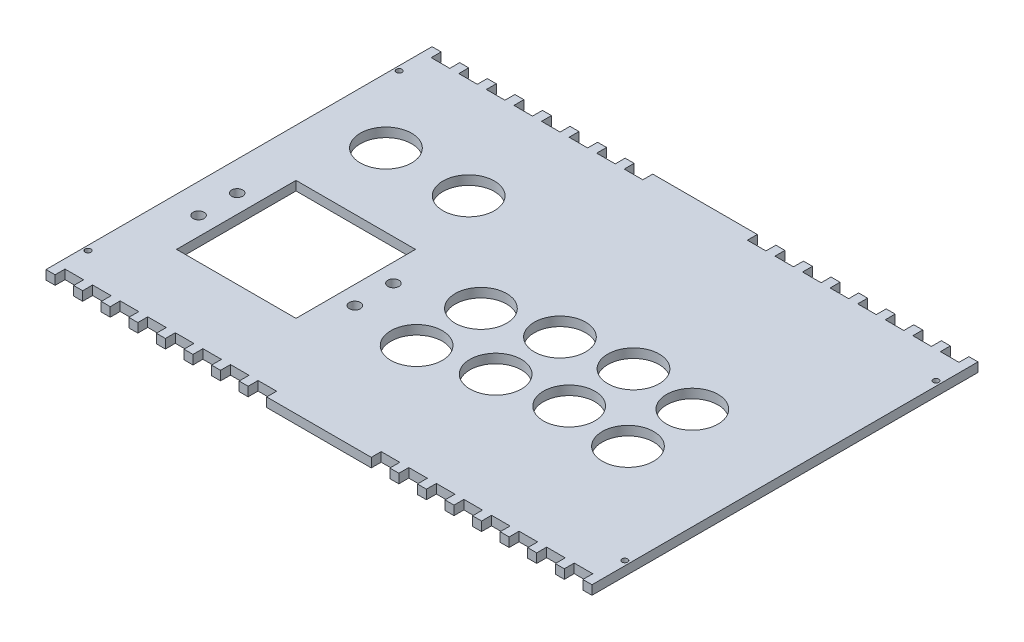
from build123d import *

# Parameters (mm, degrees)
ESQUISSE1_W                 = 297
ESQUISSE1_H                 = 210
BOSS_EXTRU_1_DEPTH          = 5
ENL_V_MAT_EXTRU_1_REACH     = 183.94
ESQUISSE2_W                 = 65
ESQUISSE2_H                 = 65
ESQUISSE2_R                 = 3
SYM_TRIE8_OUTLINE_R         = 3
SYM_TRIE8_DEPTH             = 5
ENL_V_MAT_EXTRU_2_REACH     = 183.94
ESQUISSE3_R                 = 14
ENL_V_MAT_EXTRU_3_REACH     = 183.94
ESQUISSE4_R                 = 14
R_P_TITION_LIN_AIRE1_COUNT  = 2
R_P_TITION_LIN_AIRE1_PITCH  = 35
ESQUISSE5_W                 = 10.1
ESQUISSE5_H                 = 5.4
ENL_V_MAT_EXTRU_4_DEPTH     = 5
R_P_TITION_LIN_AIRE2_COUNT  = 8
R_P_TITION_LIN_AIRE2_PITCH  = 15
SYM_TRIE9_COPY_1_SKETCH_W   = 10.1
SYM_TRIE9_COPY_1_SKETCH_H   = 5.4
SYM_TRIE9_COPY_1_DEPTH      = 5
SYM_TRIE9_COPY_2_SKETCH_W   = 10.1
SYM_TRIE9_COPY_2_SKETCH_H   = 5.4
SYM_TRIE9_COPY_2_DEPTH      = 5
SYM_TRIE9_COPY_3_SKETCH_W   = 10.1
SYM_TRIE9_COPY_3_SKETCH_H   = 5.4
SYM_TRIE9_COPY_3_DEPTH      = 5
SYM_TRIE9_COPY_4_SKETCH_W   = 10.1
SYM_TRIE9_COPY_4_SKETCH_H   = 5.4
SYM_TRIE9_COPY_4_DEPTH      = 5
SYM_TRIE9_COPY_5_SKETCH_W   = 10.1
SYM_TRIE9_COPY_5_SKETCH_H   = 5.4
SYM_TRIE9_COPY_5_DEPTH      = 5
SYM_TRIE9_COPY_6_SKETCH_W   = 10.1
SYM_TRIE9_COPY_6_SKETCH_H   = 5.4
SYM_TRIE9_COPY_6_DEPTH      = 5
SYM_TRIE9_COPY_7_SKETCH_W   = 10.1
SYM_TRIE9_COPY_7_SKETCH_H   = 5.4
SYM_TRIE9_COPY_7_DEPTH      = 5
SYM_TRIE10_COPY_1_SKETCH_W  = 10.1
SYM_TRIE10_COPY_1_SKETCH_H  = 5.4
SYM_TRIE10_COPY_1_DEPTH     = 5
SYM_TRIE10_COPY_2_SKETCH_W  = 10.1
SYM_TRIE10_COPY_2_SKETCH_H  = 5.4
SYM_TRIE10_COPY_2_DEPTH     = 5
SYM_TRIE10_COPY_3_SKETCH_W  = 10.1
SYM_TRIE10_COPY_3_SKETCH_H  = 5.4
SYM_TRIE10_COPY_3_DEPTH     = 5
SYM_TRIE10_COPY_4_SKETCH_W  = 10.1
SYM_TRIE10_COPY_4_SKETCH_H  = 5.4
SYM_TRIE10_COPY_4_DEPTH     = 5
SYM_TRIE10_COPY_5_SKETCH_W  = 10.1
SYM_TRIE10_COPY_5_SKETCH_H  = 5.4
SYM_TRIE10_COPY_5_DEPTH     = 5
SYM_TRIE10_COPY_6_SKETCH_W  = 10.1
SYM_TRIE10_COPY_6_SKETCH_H  = 5.4
SYM_TRIE10_COPY_6_DEPTH     = 5
SYM_TRIE10_COPY_7_SKETCH_W  = 10.1
SYM_TRIE10_COPY_7_SKETCH_H  = 5.4
SYM_TRIE10_COPY_7_DEPTH     = 5
SYM_TRIE10_COPY_8_SKETCH_W  = 10.1
SYM_TRIE10_COPY_8_SKETCH_H  = 5.4
SYM_TRIE10_COPY_8_DEPTH     = 5
SYM_TRIE10_COPY_9_SKETCH_W  = 10.1
SYM_TRIE10_COPY_9_SKETCH_H  = 5.4
SYM_TRIE10_COPY_9_DEPTH     = 5
SYM_TRIE10_COPY_10_SKETCH_W = 10.1
SYM_TRIE10_COPY_10_SKETCH_H = 5.4
SYM_TRIE10_COPY_10_DEPTH    = 5
SYM_TRIE10_COPY_11_SKETCH_W = 10.1
SYM_TRIE10_COPY_11_SKETCH_H = 5.4
SYM_TRIE10_COPY_11_DEPTH    = 5
SYM_TRIE10_COPY_12_SKETCH_W = 10.1
SYM_TRIE10_COPY_12_SKETCH_H = 5.4
SYM_TRIE10_COPY_12_DEPTH    = 5
SYM_TRIE10_COPY_13_SKETCH_W = 10.1
SYM_TRIE10_COPY_13_SKETCH_H = 5.4
SYM_TRIE10_COPY_13_DEPTH    = 5
SYM_TRIE10_COPY_14_SKETCH_W = 10.1
SYM_TRIE10_COPY_14_SKETCH_H = 5.4
SYM_TRIE10_COPY_14_DEPTH    = 5
SYM_TRIE10_COPY_15_SKETCH_W = 10.1
SYM_TRIE10_COPY_15_SKETCH_H = 5.4
SYM_TRIE10_COPY_15_DEPTH    = 5
ESQUISSE6_R                 = 1.55
ENL_V_MAT_EXTRU_5_DEPTH     = 5
SYM_TRIE12_COPY_1_SKETCH_R  = 1.55
SYM_TRIE12_COPY_1_DEPTH     = 5


# Read off the part's stored shape, not the designer's step: Symétrie8
with BuildPart() as part:
    # Esquisse1 → Boss.-Extru.1 (new body)
    with BuildSketch(Plane(origin=(0, 0, 0), x_dir=(1, 0, 0), z_dir=(0, 1, 0))):
        Rectangle(ESQUISSE1_W, ESQUISSE1_H)
    extrude(amount=BOSS_EXTRU_1_DEPTH)

    # Esquisse2 → Enlèv. mat.-Extru.1 (cut, up to next)
    with BuildSketch(Plane(origin=(0, 5, 0), x_dir=(1, 0, 0), z_dir=(0, 1, 0)), mode=Mode.PRIVATE) as enl_v_mat_extru_1_sk1:
        with Locations((-90, -27.5)):
            Rectangle(ESQUISSE2_W, ESQUISSE2_H)
    enl_v_mat_extru_1_tool1 = extrude(enl_v_mat_extru_1_sk1.sketch, amount=-ENL_V_MAT_EXTRU_1_REACH, mode=Mode.PRIVATE) & part.part
    # Esquisse2 → Enlèv. mat.-Extru.1 (cut, up to next)
    with BuildSketch(Plane(origin=(0, 5, 0), x_dir=(1, 0, 0), z_dir=(0, 1, 0)), mode=Mode.PRIVATE) as enl_v_mat_extru_1_sk2:
        with Locations(Location((-47.5, -17, 0), (0, 0, 270))):
            Circle(ESQUISSE2_R)
    enl_v_mat_extru_1_tool2 = extrude(enl_v_mat_extru_1_sk2.sketch, amount=-ENL_V_MAT_EXTRU_1_REACH, mode=Mode.PRIVATE) & part.part
    enl_v_mat_extru_1_1 = enl_v_mat_extru_1_tool1.solids().sort_by_distance((-90, 5, 27.5))[0]
    add(enl_v_mat_extru_1_1, mode=Mode.SUBTRACT)
    enl_v_mat_extru_1_2 = enl_v_mat_extru_1_tool2.solids().sort_by_distance((-47.5, 5, 17))[0]
    add(enl_v_mat_extru_1_2, mode=Mode.SUBTRACT)
    enl_v_mat_extru_1 = enl_v_mat_extru_1_1 + enl_v_mat_extru_1_2  # Enlèv. mat.-Extru.1 as one shape, for the pattern or mirror that repeats it

    # Symétrie6: Enlèv. mat.-Extru.1 across plane
    add(enl_v_mat_extru_1.mirror(Plane.XY.offset(27.5)), mode=Mode.SUBTRACT)

    # Symétrie8 outline → Symétrie8 (cut)
    with BuildSketch(Plane(origin=(0, 0, 0), x_dir=(1, 0, 0), z_dir=(0, 1, 0))):
        with Locations((-132.5, -17)):
            Circle(SYM_TRIE8_OUTLINE_R)
        with Locations((-132.5, -38)):
            Circle(SYM_TRIE8_OUTLINE_R)
    extrude(amount=SYM_TRIE8_DEPTH, mode=Mode.SUBTRACT)

    # Esquisse3 → Enlèv. mat.-Extru.2 (cut, up to next)
    with BuildSketch(Plane(origin=(0, 5, 0), x_dir=(1, 0, 0), z_dir=(0, 1, 0)), mode=Mode.PRIVATE) as enl_v_mat_extru_2_sk1:
        with Locations(Location((-113.259211651, 44.697600862, 0), (0, 0, 270))):
            Circle(ESQUISSE3_R)
    enl_v_mat_extru_2_tool1 = extrude(enl_v_mat_extru_2_sk1.sketch, amount=-ENL_V_MAT_EXTRU_2_REACH, mode=Mode.PRIVATE) & part.part
    # Esquisse3 → Enlèv. mat.-Extru.2 (cut, up to next)
    with BuildSketch(Plane(origin=(0, 5, 0), x_dir=(1, 0, 0), z_dir=(0, 1, 0)), mode=Mode.PRIVATE) as enl_v_mat_extru_2_sk2:
        with Locations(Location((-68.259211651, 44.697600862, 0), (0, 0, 270))):
            Circle(ESQUISSE3_R)
    enl_v_mat_extru_2_tool2 = extrude(enl_v_mat_extru_2_sk2.sketch, amount=-ENL_V_MAT_EXTRU_2_REACH, mode=Mode.PRIVATE) & part.part
    add(enl_v_mat_extru_2_tool1.solids().sort_by_distance((-113.259212, 5, -44.697601))[0], mode=Mode.SUBTRACT)
    add(enl_v_mat_extru_2_tool2.solids().sort_by_distance((-68.259212, 5, -44.697601))[0], mode=Mode.SUBTRACT)

    # Esquisse4 → Enlèv. mat.-Extru.3 (cut, up to next)
    with BuildSketch(Plane(origin=(0, 5, 0), x_dir=(1, 0, 0), z_dir=(0, 1, 0)), mode=Mode.PRIVATE) as enl_v_mat_extru_3_sk1:
        with Locations(Location((-11.9, -40, 0), (0, 0, 270))):
            Circle(ESQUISSE4_R)
    enl_v_mat_extru_3_tool1 = extrude(enl_v_mat_extru_3_sk1.sketch, amount=-ENL_V_MAT_EXTRU_3_REACH, mode=Mode.PRIVATE) & part.part
    # Esquisse4 → Enlèv. mat.-Extru.3 (cut, up to next)
    with BuildSketch(Plane(origin=(0, 5, 0), x_dir=(1, 0, 0), z_dir=(0, 1, 0)), mode=Mode.PRIVATE) as enl_v_mat_extru_3_sk2:
        with Locations(Location((23.1, -32, 0), (0, 0, 270))):
            Circle(ESQUISSE4_R)
    enl_v_mat_extru_3_tool2 = extrude(enl_v_mat_extru_3_sk2.sketch, amount=-ENL_V_MAT_EXTRU_3_REACH, mode=Mode.PRIVATE) & part.part
    # Esquisse4 → Enlèv. mat.-Extru.3 (cut, up to next)
    with BuildSketch(Plane(origin=(0, 5, 0), x_dir=(1, 0, 0), z_dir=(0, 1, 0)), mode=Mode.PRIVATE) as enl_v_mat_extru_3_sk3:
        with Locations(Location((58.1, -27, 0), (0, 0, 270))):
            Circle(ESQUISSE4_R)
    enl_v_mat_extru_3_tool3 = extrude(enl_v_mat_extru_3_sk3.sketch, amount=-ENL_V_MAT_EXTRU_3_REACH, mode=Mode.PRIVATE) & part.part
    # Esquisse4 → Enlèv. mat.-Extru.3 (cut, up to next)
    with BuildSketch(Plane(origin=(0, 5, 0), x_dir=(1, 0, 0), z_dir=(0, 1, 0)), mode=Mode.PRIVATE) as enl_v_mat_extru_3_sk4:
        with Locations(Location((93.1, -30, 0), (0, 0, 270))):
            Circle(ESQUISSE4_R)
    enl_v_mat_extru_3_tool4 = extrude(enl_v_mat_extru_3_sk4.sketch, amount=-ENL_V_MAT_EXTRU_3_REACH, mode=Mode.PRIVATE) & part.part
    enl_v_mat_extru_3_1 = enl_v_mat_extru_3_tool1.solids().sort_by_distance((-11.9, 5, 40))[0]
    add(enl_v_mat_extru_3_1, mode=Mode.SUBTRACT)
    enl_v_mat_extru_3_2 = enl_v_mat_extru_3_tool2.solids().sort_by_distance((23.1, 5, 32))[0]
    add(enl_v_mat_extru_3_2, mode=Mode.SUBTRACT)
    enl_v_mat_extru_3_3 = enl_v_mat_extru_3_tool3.solids().sort_by_distance((58.1, 5, 27))[0]
    add(enl_v_mat_extru_3_3, mode=Mode.SUBTRACT)
    enl_v_mat_extru_3_4 = enl_v_mat_extru_3_tool4.solids().sort_by_distance((93.1, 5, 30))[0]
    add(enl_v_mat_extru_3_4, mode=Mode.SUBTRACT)
    enl_v_mat_extru_3 = enl_v_mat_extru_3_1 + enl_v_mat_extru_3_2 + enl_v_mat_extru_3_3 + enl_v_mat_extru_3_4  # Enlèv. mat.-Extru.3 as one shape, for the pattern or mirror that repeats it

    # Répétition linéaire1: Enlèv. mat.-Extru.3 ×2
    with Locations(*[(0, 0, -i * R_P_TITION_LIN_AIRE1_PITCH) for i in range(1, R_P_TITION_LIN_AIRE1_COUNT)]):
        add(enl_v_mat_extru_3, mode=Mode.SUBTRACT)

    # Esquisse5 → Enlèv. mat.-Extru.4 (cut)
    with BuildSketch(Plane(origin=(0, 0, 0), x_dir=(-1, 0, 0), z_dir=(0, -1, 0))):
        with Locations((138.5, 102.3)):
            Rectangle(ESQUISSE5_W, ESQUISSE5_H)
    enl_v_mat_extru_4 = extrude(amount=-ENL_V_MAT_EXTRU_4_DEPTH, mode=Mode.SUBTRACT)

    # Répétition linéaire2: Enlèv. mat.-Extru.4 ×8
    with Locations(*[(i * R_P_TITION_LIN_AIRE2_PITCH, 0, 0) for i in range(1, R_P_TITION_LIN_AIRE2_COUNT)]):
        add(enl_v_mat_extru_4, mode=Mode.SUBTRACT)

    # Symétrie9: Enlèv. mat.-Extru.4 across plane
    add(enl_v_mat_extru_4.mirror(Plane.ZY), mode=Mode.SUBTRACT)

    # Symétrie9 copy 1 sketch → Symétrie9 copy 1 (cut)
    with BuildSketch(Plane(origin=(-15, 0, 0), x_dir=(1, 0, 0), z_dir=(0, -1, 0))):
        with Locations((138.5, -102.3)):
            Rectangle(SYM_TRIE9_COPY_1_SKETCH_W, SYM_TRIE9_COPY_1_SKETCH_H)
    extrude(amount=-SYM_TRIE9_COPY_1_DEPTH, mode=Mode.SUBTRACT)

    # Symétrie9 copy 2 sketch → Symétrie9 copy 2 (cut)
    with BuildSketch(Plane(origin=(-30, 0, 0), x_dir=(1, 0, 0), z_dir=(0, -1, 0))):
        with Locations((138.5, -102.3)):
            Rectangle(SYM_TRIE9_COPY_2_SKETCH_W, SYM_TRIE9_COPY_2_SKETCH_H)
    extrude(amount=-SYM_TRIE9_COPY_2_DEPTH, mode=Mode.SUBTRACT)

    # Symétrie9 copy 3 sketch → Symétrie9 copy 3 (cut)
    with BuildSketch(Plane(origin=(-45, 0, 0), x_dir=(1, 0, 0), z_dir=(0, -1, 0))):
        with Locations((138.5, -102.3)):
            Rectangle(SYM_TRIE9_COPY_3_SKETCH_W, SYM_TRIE9_COPY_3_SKETCH_H)
    extrude(amount=-SYM_TRIE9_COPY_3_DEPTH, mode=Mode.SUBTRACT)

    # Symétrie9 copy 4 sketch → Symétrie9 copy 4 (cut)
    with BuildSketch(Plane(origin=(-60, 0, 0), x_dir=(1, 0, 0), z_dir=(0, -1, 0))):
        with Locations((138.5, -102.3)):
            Rectangle(SYM_TRIE9_COPY_4_SKETCH_W, SYM_TRIE9_COPY_4_SKETCH_H)
    extrude(amount=-SYM_TRIE9_COPY_4_DEPTH, mode=Mode.SUBTRACT)

    # Symétrie9 copy 5 sketch → Symétrie9 copy 5 (cut)
    with BuildSketch(Plane(origin=(-75, 0, 0), x_dir=(1, 0, 0), z_dir=(0, -1, 0))):
        with Locations((138.5, -102.3)):
            Rectangle(SYM_TRIE9_COPY_5_SKETCH_W, SYM_TRIE9_COPY_5_SKETCH_H)
    extrude(amount=-SYM_TRIE9_COPY_5_DEPTH, mode=Mode.SUBTRACT)

    # Symétrie9 copy 6 sketch → Symétrie9 copy 6 (cut)
    with BuildSketch(Plane(origin=(-90, 0, 0), x_dir=(1, 0, 0), z_dir=(0, -1, 0))):
        with Locations((138.5, -102.3)):
            Rectangle(SYM_TRIE9_COPY_6_SKETCH_W, SYM_TRIE9_COPY_6_SKETCH_H)
    extrude(amount=-SYM_TRIE9_COPY_6_DEPTH, mode=Mode.SUBTRACT)

    # Symétrie9 copy 7 sketch → Symétrie9 copy 7 (cut)
    with BuildSketch(Plane(origin=(-105, 0, 0), x_dir=(1, 0, 0), z_dir=(0, -1, 0))):
        with Locations((138.5, -102.3)):
            Rectangle(SYM_TRIE9_COPY_7_SKETCH_W, SYM_TRIE9_COPY_7_SKETCH_H)
    extrude(amount=-SYM_TRIE9_COPY_7_DEPTH, mode=Mode.SUBTRACT)

    # Symétrie10: Enlèv. mat.-Extru.4 across plane
    add(enl_v_mat_extru_4.mirror(Plane(origin=(0, 0, 0), x_dir=(1, 0, 0), z_dir=(0, 0, -1))), mode=Mode.SUBTRACT)

    # Symétrie10 copy 1 sketch → Symétrie10 copy 1 (cut)
    with BuildSketch(Plane(origin=(15, 0, 0), x_dir=(-1, 0, 0), z_dir=(0, -1, 0))):
        with Locations((138.5, -102.3)):
            Rectangle(SYM_TRIE10_COPY_1_SKETCH_W, SYM_TRIE10_COPY_1_SKETCH_H)
    extrude(amount=-SYM_TRIE10_COPY_1_DEPTH, mode=Mode.SUBTRACT)

    # Symétrie10 copy 2 sketch → Symétrie10 copy 2 (cut)
    with BuildSketch(Plane(origin=(30, 0, 0), x_dir=(-1, 0, 0), z_dir=(0, -1, 0))):
        with Locations((138.5, -102.3)):
            Rectangle(SYM_TRIE10_COPY_2_SKETCH_W, SYM_TRIE10_COPY_2_SKETCH_H)
    extrude(amount=-SYM_TRIE10_COPY_2_DEPTH, mode=Mode.SUBTRACT)

    # Symétrie10 copy 3 sketch → Symétrie10 copy 3 (cut)
    with BuildSketch(Plane(origin=(45, 0, 0), x_dir=(-1, 0, 0), z_dir=(0, -1, 0))):
        with Locations((138.5, -102.3)):
            Rectangle(SYM_TRIE10_COPY_3_SKETCH_W, SYM_TRIE10_COPY_3_SKETCH_H)
    extrude(amount=-SYM_TRIE10_COPY_3_DEPTH, mode=Mode.SUBTRACT)

    # Symétrie10 copy 4 sketch → Symétrie10 copy 4 (cut)
    with BuildSketch(Plane(origin=(60, 0, 0), x_dir=(-1, 0, 0), z_dir=(0, -1, 0))):
        with Locations((138.5, -102.3)):
            Rectangle(SYM_TRIE10_COPY_4_SKETCH_W, SYM_TRIE10_COPY_4_SKETCH_H)
    extrude(amount=-SYM_TRIE10_COPY_4_DEPTH, mode=Mode.SUBTRACT)

    # Symétrie10 copy 5 sketch → Symétrie10 copy 5 (cut)
    with BuildSketch(Plane(origin=(75, 0, 0), x_dir=(-1, 0, 0), z_dir=(0, -1, 0))):
        with Locations((138.5, -102.3)):
            Rectangle(SYM_TRIE10_COPY_5_SKETCH_W, SYM_TRIE10_COPY_5_SKETCH_H)
    extrude(amount=-SYM_TRIE10_COPY_5_DEPTH, mode=Mode.SUBTRACT)

    # Symétrie10 copy 6 sketch → Symétrie10 copy 6 (cut)
    with BuildSketch(Plane(origin=(90, 0, 0), x_dir=(-1, 0, 0), z_dir=(0, -1, 0))):
        with Locations((138.5, -102.3)):
            Rectangle(SYM_TRIE10_COPY_6_SKETCH_W, SYM_TRIE10_COPY_6_SKETCH_H)
    extrude(amount=-SYM_TRIE10_COPY_6_DEPTH, mode=Mode.SUBTRACT)

    # Symétrie10 copy 7 sketch → Symétrie10 copy 7 (cut)
    with BuildSketch(Plane(origin=(105, 0, 0), x_dir=(-1, 0, 0), z_dir=(0, -1, 0))):
        with Locations((138.5, -102.3)):
            Rectangle(SYM_TRIE10_COPY_7_SKETCH_W, SYM_TRIE10_COPY_7_SKETCH_H)
    extrude(amount=-SYM_TRIE10_COPY_7_DEPTH, mode=Mode.SUBTRACT)

    # Symétrie10 copy 8 sketch → Symétrie10 copy 8 (cut)
    with BuildSketch(Plane.XZ):
        with Locations((138.5, 102.3)):
            Rectangle(SYM_TRIE10_COPY_8_SKETCH_W, SYM_TRIE10_COPY_8_SKETCH_H)
    extrude(amount=-SYM_TRIE10_COPY_8_DEPTH, mode=Mode.SUBTRACT)

    # Symétrie10 copy 9 sketch → Symétrie10 copy 9 (cut)
    with BuildSketch(Plane(origin=(-15, 0, 0), x_dir=(1, 0, 0), z_dir=(0, -1, 0))):
        with Locations((138.5, 102.3)):
            Rectangle(SYM_TRIE10_COPY_9_SKETCH_W, SYM_TRIE10_COPY_9_SKETCH_H)
    extrude(amount=-SYM_TRIE10_COPY_9_DEPTH, mode=Mode.SUBTRACT)

    # Symétrie10 copy 10 sketch → Symétrie10 copy 10 (cut)
    with BuildSketch(Plane(origin=(-30, 0, 0), x_dir=(1, 0, 0), z_dir=(0, -1, 0))):
        with Locations((138.5, 102.3)):
            Rectangle(SYM_TRIE10_COPY_10_SKETCH_W, SYM_TRIE10_COPY_10_SKETCH_H)
    extrude(amount=-SYM_TRIE10_COPY_10_DEPTH, mode=Mode.SUBTRACT)

    # Symétrie10 copy 11 sketch → Symétrie10 copy 11 (cut)
    with BuildSketch(Plane(origin=(-45, 0, 0), x_dir=(1, 0, 0), z_dir=(0, -1, 0))):
        with Locations((138.5, 102.3)):
            Rectangle(SYM_TRIE10_COPY_11_SKETCH_W, SYM_TRIE10_COPY_11_SKETCH_H)
    extrude(amount=-SYM_TRIE10_COPY_11_DEPTH, mode=Mode.SUBTRACT)

    # Symétrie10 copy 12 sketch → Symétrie10 copy 12 (cut)
    with BuildSketch(Plane(origin=(-60, 0, 0), x_dir=(1, 0, 0), z_dir=(0, -1, 0))):
        with Locations((138.5, 102.3)):
            Rectangle(SYM_TRIE10_COPY_12_SKETCH_W, SYM_TRIE10_COPY_12_SKETCH_H)
    extrude(amount=-SYM_TRIE10_COPY_12_DEPTH, mode=Mode.SUBTRACT)

    # Symétrie10 copy 13 sketch → Symétrie10 copy 13 (cut)
    with BuildSketch(Plane(origin=(-75, 0, 0), x_dir=(1, 0, 0), z_dir=(0, -1, 0))):
        with Locations((138.5, 102.3)):
            Rectangle(SYM_TRIE10_COPY_13_SKETCH_W, SYM_TRIE10_COPY_13_SKETCH_H)
    extrude(amount=-SYM_TRIE10_COPY_13_DEPTH, mode=Mode.SUBTRACT)

    # Symétrie10 copy 14 sketch → Symétrie10 copy 14 (cut)
    with BuildSketch(Plane(origin=(-90, 0, 0), x_dir=(1, 0, 0), z_dir=(0, -1, 0))):
        with Locations((138.5, 102.3)):
            Rectangle(SYM_TRIE10_COPY_14_SKETCH_W, SYM_TRIE10_COPY_14_SKETCH_H)
    extrude(amount=-SYM_TRIE10_COPY_14_DEPTH, mode=Mode.SUBTRACT)

    # Symétrie10 copy 15 sketch → Symétrie10 copy 15 (cut)
    with BuildSketch(Plane(origin=(-105, 0, 0), x_dir=(1, 0, 0), z_dir=(0, -1, 0))):
        with Locations((138.5, 102.3)):
            Rectangle(SYM_TRIE10_COPY_15_SKETCH_W, SYM_TRIE10_COPY_15_SKETCH_H)
    extrude(amount=-SYM_TRIE10_COPY_15_DEPTH, mode=Mode.SUBTRACT)

    # Esquisse6 → Enlèv. mat.-Extru.5 (cut)
    with BuildSketch(Plane(origin=(0, 0, 0), x_dir=(-1, 0, 0), z_dir=(0, -1, 0))):
        with Locations(Location((-146, -84.65203993, 0), (0, 0, 90))):
            Circle(ESQUISSE6_R)
    enl_v_mat_extru_5 = extrude(amount=-ENL_V_MAT_EXTRU_5_DEPTH, mode=Mode.SUBTRACT)

    # Symétrie11: Enlèv. mat.-Extru.5 across plane
    add(enl_v_mat_extru_5.mirror(Plane.ZY), mode=Mode.SUBTRACT)

    # Symétrie12: Enlèv. mat.-Extru.5 across plane
    add(enl_v_mat_extru_5.mirror(Plane(origin=(0, 0, 0), x_dir=(1, 0, 0), z_dir=(0, 0, -1))), mode=Mode.SUBTRACT)

    # Symétrie12 copy 1 sketch → Symétrie12 copy 1 (cut)
    with BuildSketch(Plane.XZ):
        with Locations(Location((-146, -84.65203993, 0), (0, 0, 90))):
            Circle(SYM_TRIE12_COPY_1_SKETCH_R)
    extrude(amount=-SYM_TRIE12_COPY_1_DEPTH, mode=Mode.SUBTRACT)


solid = part.part
